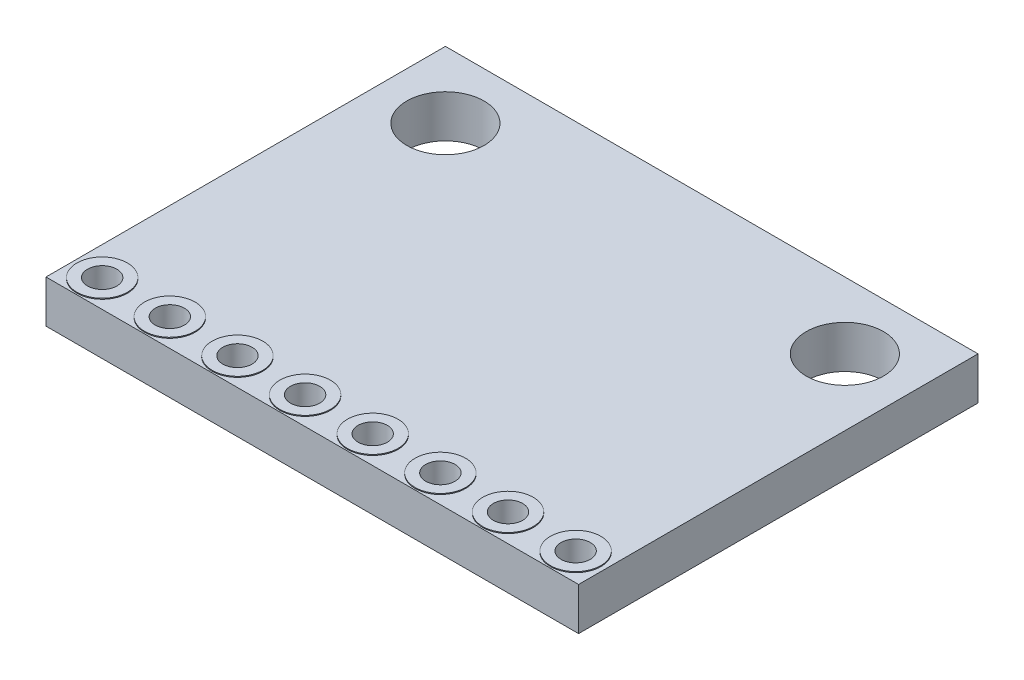
from build123d import *

# Parameters (mm, degrees)
ESBO_O1_W                = 20
ESBO_O1_H                = 15
ESBO_O1_R                = 1.45
ESBO_O1_R_2              = 0.55
RESSALTO_EXTRUS_O1_DEPTH = 1.6
ESBO_O2_R                = 0.95
ESBO_O2_R_2              = 0.55
RESSALTO_EXTRUS_O2_DEPTH = 0.035
RESSALTO_EXTRUS_O3_START = 0.035
ESBO_O3_R                = 0.95
ESBO_O3_R_2              = 0.55
RESSALTO_EXTRUS_O3_DEPTH = 0.035


with BuildPart() as part:
    # Esboço1 → Ressalto-extrusão1 (new body)
    with BuildSketch(Plane(origin=(0, 0, 0), x_dir=(1, 0, 0), z_dir=(0, 1, 0))):
        Rectangle(ESBO_O1_W, ESBO_O1_H)
        with Locations((-7.5, 5)):
            Circle(ESBO_O1_R, mode=Mode.SUBTRACT)
        with Locations((7.5, 5)):
            Circle(ESBO_O1_R, mode=Mode.SUBTRACT)
        with Locations((-1.27, -6.5)):
            Circle(ESBO_O1_R_2, mode=Mode.SUBTRACT)
        with Locations((-3.81, -6.5)):
            Circle(ESBO_O1_R_2, mode=Mode.SUBTRACT)
        with Locations((-6.35, -6.5)):
            Circle(ESBO_O1_R_2, mode=Mode.SUBTRACT)
        with Locations((-8.89, -6.5)):
            Circle(ESBO_O1_R_2, mode=Mode.SUBTRACT)
        with Locations((1.27, -6.5)):
            Circle(ESBO_O1_R_2, mode=Mode.SUBTRACT)
        with Locations((3.81, -6.5)):
            Circle(ESBO_O1_R_2, mode=Mode.SUBTRACT)
        with Locations((6.35, -6.5)):
            Circle(ESBO_O1_R_2, mode=Mode.SUBTRACT)
        with Locations((8.89, -6.5)):
            Circle(ESBO_O1_R_2, mode=Mode.SUBTRACT)
    extrude(amount=RESSALTO_EXTRUS_O1_DEPTH)

    # Esboço2 → Ressalto-extrusão2 (add)
    # profile 1 of 8: a face of its own
    with BuildSketch(Plane(origin=(0, 1.6, 0), x_dir=(1, 0, 0), z_dir=(0, 1, 0))):
        with Locations((-6.35, -6.5)):
            Circle(ESBO_O2_R)
        with Locations((-6.35, -6.5)):
            Circle(ESBO_O2_R_2, mode=Mode.SUBTRACT)
    # profile 2 of 8: a face of its own
    with BuildSketch(Plane(origin=(0, 1.6, 0), x_dir=(1, 0, 0), z_dir=(0, 1, 0))):
        with Locations((-8.89, -6.5)):
            Circle(ESBO_O2_R)
        with Locations((-8.89, -6.5)):
            Circle(ESBO_O2_R_2, mode=Mode.SUBTRACT)
    # profile 3 of 8: a face of its own
    with BuildSketch(Plane(origin=(0, 1.6, 0), x_dir=(1, 0, 0), z_dir=(0, 1, 0))):
        with Locations((-3.81, -6.5)):
            Circle(ESBO_O2_R)
        with Locations((-3.81, -6.5)):
            Circle(ESBO_O2_R_2, mode=Mode.SUBTRACT)
    # profile 4 of 8: a face of its own
    with BuildSketch(Plane(origin=(0, 1.6, 0), x_dir=(1, 0, 0), z_dir=(0, 1, 0))):
        with Locations((-1.27, -6.5)):
            Circle(ESBO_O2_R)
        with Locations((-1.27, -6.5)):
            Circle(ESBO_O2_R_2, mode=Mode.SUBTRACT)
    # profile 5 of 8: a face of its own
    with BuildSketch(Plane(origin=(0, 1.6, 0), x_dir=(1, 0, 0), z_dir=(0, 1, 0))):
        with Locations((1.27, -6.5)):
            Circle(ESBO_O2_R)
        with Locations((1.27, -6.5)):
            Circle(ESBO_O2_R_2, mode=Mode.SUBTRACT)
    # profile 6 of 8: a face of its own
    with BuildSketch(Plane(origin=(0, 1.6, 0), x_dir=(1, 0, 0), z_dir=(0, 1, 0))):
        with Locations((3.81, -6.5)):
            Circle(ESBO_O2_R)
        with Locations((3.81, -6.5)):
            Circle(ESBO_O2_R_2, mode=Mode.SUBTRACT)
    # profile 7 of 8: a face of its own
    with BuildSketch(Plane(origin=(0, 1.6, 0), x_dir=(1, 0, 0), z_dir=(0, 1, 0))):
        with Locations((6.35, -6.5)):
            Circle(ESBO_O2_R)
        with Locations((6.35, -6.5)):
            Circle(ESBO_O2_R_2, mode=Mode.SUBTRACT)
    # profile 8 of 8: a face of its own
    with BuildSketch(Plane(origin=(0, 1.6, 0), x_dir=(1, 0, 0), z_dir=(0, 1, 0))):
        with Locations((8.89, -6.5)):
            Circle(ESBO_O2_R)
        with Locations((8.89, -6.5)):
            Circle(ESBO_O2_R_2, mode=Mode.SUBTRACT)
    extrude(amount=RESSALTO_EXTRUS_O2_DEPTH)

    # Esboço3 → Ressalto-extrusão3 (add)
    # profile 1 of 8: a face of its own
    with BuildSketch(Plane.XZ.offset(RESSALTO_EXTRUS_O3_START)):
        with Locations((8.89, 6.5)):
            Circle(ESBO_O3_R)
        with Locations((8.89, 6.5)):
            Circle(ESBO_O3_R_2, mode=Mode.SUBTRACT)
    # profile 2 of 8: a face of its own
    with BuildSketch(Plane.XZ.offset(RESSALTO_EXTRUS_O3_START)):
        with Locations((6.35, 6.5)):
            Circle(ESBO_O3_R)
        with Locations((6.35, 6.5)):
            Circle(ESBO_O3_R_2, mode=Mode.SUBTRACT)
    # profile 3 of 8: a face of its own
    with BuildSketch(Plane.XZ.offset(RESSALTO_EXTRUS_O3_START)):
        with Locations((3.81, 6.5)):
            Circle(ESBO_O3_R)
        with Locations((3.81, 6.5)):
            Circle(ESBO_O3_R_2, mode=Mode.SUBTRACT)
    # profile 4 of 8: a face of its own
    with BuildSketch(Plane.XZ.offset(RESSALTO_EXTRUS_O3_START)):
        with Locations((1.27, 6.5)):
            Circle(ESBO_O3_R)
        with Locations((1.27, 6.5)):
            Circle(ESBO_O3_R_2, mode=Mode.SUBTRACT)
    # profile 5 of 8: a face of its own
    with BuildSketch(Plane.XZ.offset(RESSALTO_EXTRUS_O3_START)):
        with Locations((-1.27, 6.5)):
            Circle(ESBO_O3_R)
        with Locations((-1.27, 6.5)):
            Circle(ESBO_O3_R_2, mode=Mode.SUBTRACT)
    # profile 6 of 8: a face of its own
    with BuildSketch(Plane.XZ.offset(RESSALTO_EXTRUS_O3_START)):
        with Locations((-3.81, 6.5)):
            Circle(ESBO_O3_R)
        with Locations((-3.81, 6.5)):
            Circle(ESBO_O3_R_2, mode=Mode.SUBTRACT)
    # profile 7 of 8: a face of its own
    with BuildSketch(Plane.XZ.offset(RESSALTO_EXTRUS_O3_START)):
        with Locations((-6.35, 6.5)):
            Circle(ESBO_O3_R)
        with Locations((-6.35, 6.5)):
            Circle(ESBO_O3_R_2, mode=Mode.SUBTRACT)
    # profile 8 of 8: a face of its own
    with BuildSketch(Plane.XZ.offset(RESSALTO_EXTRUS_O3_START)):
        with Locations((-8.89, 6.5)):
            Circle(ESBO_O3_R)
        with Locations((-8.89, 6.5)):
            Circle(ESBO_O3_R_2, mode=Mode.SUBTRACT)
    extrude(amount=-RESSALTO_EXTRUS_O3_DEPTH)


solid = part.part
